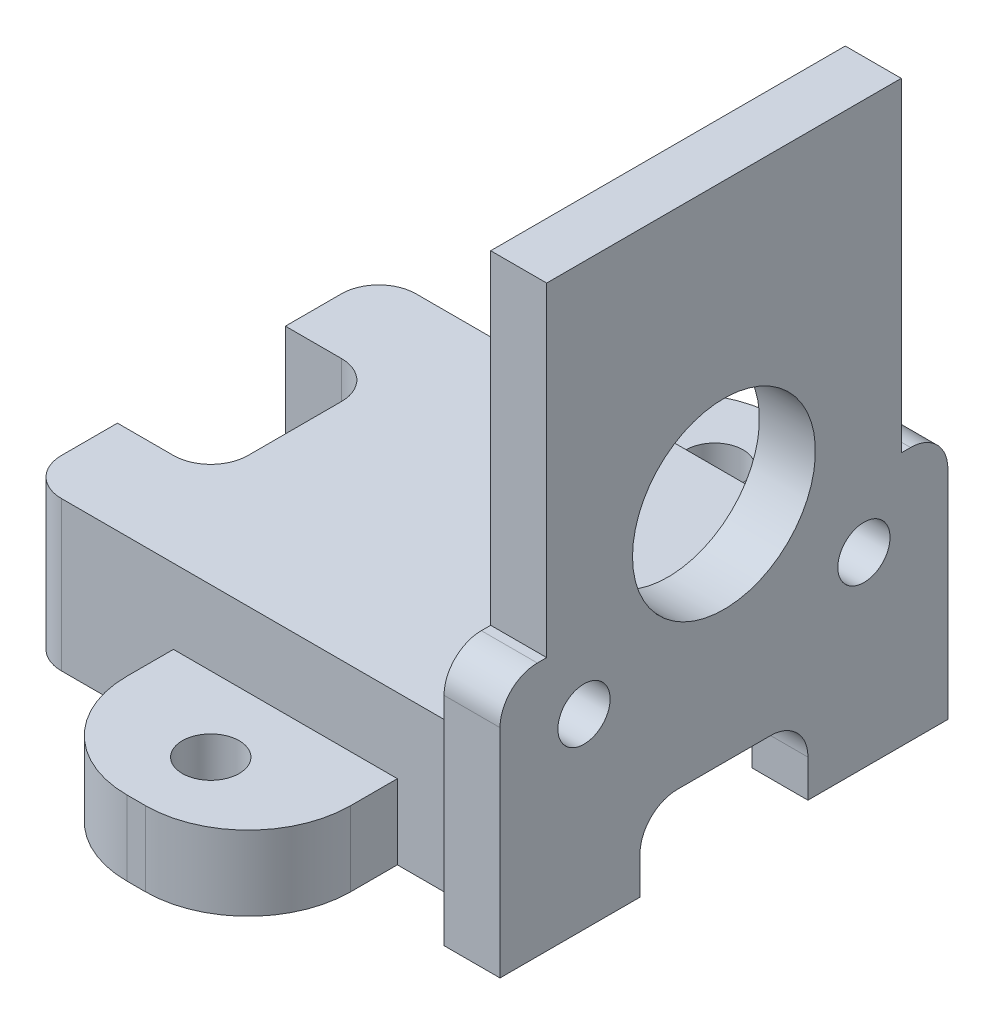
from build123d import *

# Parameters (mm, degrees)
SKETCH1_W           = 22
SKETCH1_H           = 13
BOSS_EXTRUDE1_DEPTH = 6
BOSS_EXTRUDE2_DEPTH = 2
BOSS_EXTRUDE3_DEPTH = 8
SKETCH4_R           = 1.525
SKETCH4_R_2         = 1.524
CUT_EXTRUDE1_DEPTH  = 36.566838488
SKETCH5_W           = 9
SKETCH5_H           = 4
CUT_EXTRUDE2_DEPTH  = 38.735924528
FILLET1_R           = 2
SKETCH6_W           = 12
SKETCH6_H           = 13.009000019
SKETCH6_W_2         = 15.838286437
CUT_EXTRUDE3_DEPTH  = 4
BOSS_EXTRUDE4_DEPTH = 23
CUT_EXTRUDE4_DEPTH  = 23
SKETCH9_R           = 4.9
CUT_EXTRUDE6_DEPTH  = 23
SKETCH10_R          = 1.4
CUT_EXTRUDE7_DEPTH  = 23
BOSS_EXTRUDE5_DEPTH = 3
FILLET2_R           = 2.5
FILLET3_R           = 2.5


with BuildPart() as part:
    # Sketch1 → Boss-Extrude1 (new body)
    with BuildSketch(Plane(origin=(0, 0, 0), x_dir=(1, 0, 0), z_dir=(0, 1, 0))):
        with BuildLine():
            Line((-1, -3), (23, -3))
            Line((23, -3), (25, -3))
            Line((25, -3), (25, -1))
            Line((25, -1), (25, 14))
            Line((25, 14), (25, 16))
            Line((25, 16), (23, 16))
            Line((23, 16), (-1, 16))
            ThreePointArc((-1, 16), (-2.414213562, 15.414213562), (-3, 14))
            Line((-3, 14), (-3, -1))
            ThreePointArc((-3, -1), (-2.414213562, -2.414213562), (-1, -3))
        make_face()
        with Locations((11, 6.5)):
            Rectangle(SKETCH1_W, SKETCH1_H, mode=Mode.SUBTRACT)
    extrude(amount=BOSS_EXTRUDE1_DEPTH)

    # Sketch2 → Boss-Extrude2 (add)
    with BuildSketch(Plane(origin=(0, 6, 0), x_dir=(1, 0, 0), z_dir=(0, 1, 0))):
        with BuildLine():
            Line((25, 14), (25, -1))
            Line((25, -1), (25, -3))
            Line((25, -3), (23, -3))
            Line((23, -3), (-1, -3))
            ThreePointArc((-1, -3), (-2.414213562, -2.414213562), (-3, -1))
            Line((-3, -1), (-3, 14))
            ThreePointArc((-3, 14), (-2.414213562, 15.414213562), (-1, 16))
            Line((-1, 16), (23, 16))
            Line((23, 16), (25, 16))
            Line((25, 16), (25, 14))
        make_face()
    extrude(amount=BOSS_EXTRUDE2_DEPTH)

    # Sketch3 → Boss-Extrude3 (add)
    with BuildSketch(Plane.XZ):
        with BuildLine():
            Line((5, 3), (17, 3))
            Line((17, 3), (17, 5.5))
            ThreePointArc((17, 5.5), (15.389087297, 9.389087297), (11.5, 11))
            Line((11.5, 11), (10.5, 11))
            ThreePointArc((10.5, 11), (6.610912703, 9.389087297), (5, 5.5))
            Line((5, 5.5), (5, 3))
        make_face()
        with BuildLine():
            Line((17, -16), (5, -16))
            Line((5, -16), (5, -18.5))
            ThreePointArc((5, -18.5), (6.610912703, -22.389087297), (10.5, -24))
            Line((10.5, -24), (11.5, -24))
            ThreePointArc((11.5, -24), (15.389087297, -22.389087297), (17, -18.5))
            Line((17, -18.5), (17, -16))
        make_face()
    extrude(amount=-BOSS_EXTRUDE3_DEPTH)

    # Sketch4 → Cut-Extrude1 (cut, through all)
    with BuildSketch(Plane(origin=(0, 0, 0), x_dir=(-1, 0, 0), z_dir=(0, -1, 0))):
        with Locations(Location((-11, 20, 0), (0, 0, 90))):
            Circle(SKETCH4_R)
        with Locations(Location((-11, -7, 0), (0, 0, 90))):
            Circle(SKETCH4_R_2)
    extrude(amount=-CUT_EXTRUDE1_DEPTH, mode=Mode.SUBTRACT)

    # Sketch5 → Cut-Extrude2 (cut, through all)
    with BuildSketch(Plane(origin=(25, 0, 0), x_dir=(0, 0, -1), z_dir=(1, 0, 0))):
        with Locations((6.5, 2)):
            Rectangle(SKETCH5_W, SKETCH5_H)
    extrude(amount=-CUT_EXTRUDE2_DEPTH, mode=Mode.SUBTRACT)

    # Fillet1
    fillet1_edges = [part.edges().sort_by_distance(p)[0] for p in [
        (-1.5, 4, -11),
        (-1.5, 4, -2),
        (23.5, 4, -11),
        (23.5, 4, -2),
    ]]
    fillet(fillet1_edges, radius=FILLET1_R)

    # Sketch6 → Cut-Extrude3 (cut)
    with BuildSketch(Plane(origin=(0, 8, 0), x_dir=(1, 0, 0), z_dir=(0, 1, 0))):
        with Locations((11, 22.504500009)):
            Rectangle(SKETCH6_W, SKETCH6_H)
        with Locations((11.149066226, -9.50450001)):
            Rectangle(SKETCH6_W_2, SKETCH6_H)
    extrude(amount=-CUT_EXTRUDE3_DEPTH, mode=Mode.SUBTRACT)

    # Sketch7 → Boss-Extrude4 (add)
    with BuildSketch(Plane(origin=(0, 8, 0), x_dir=(1, 0, 0), z_dir=(0, 1, 0))):
        Polygon((23, 16), (22, 16), (22, -3), (23, -3), (25, -3), (25, -1), (25, 14), (25, 16), align=None)
    extrude(amount=BOSS_EXTRUDE4_DEPTH)

    # Sketch8 → Cut-Extrude4 (cut)
    with BuildSketch(Plane(origin=(0, 8, 0), x_dir=(1, 0, 0), z_dir=(0, 1, 0))):
        with BuildLine():
            Line((-3, 2), (0, 2))
            ThreePointArc((0, 2), (1.414213562, 2.585786438), (2, 4))
            Line((2, 4), (2, 9))
            ThreePointArc((2, 9), (1.414213562, 10.414213562), (0, 11))
            Line((0, 11), (-3, 11))
            Line((-3, 11), (-3, 2))
        make_face()
    extrude(amount=-CUT_EXTRUDE4_DEPTH, mode=Mode.SUBTRACT)

    # Sketch9 → Cut-Extrude6 (cut)
    with BuildSketch(Plane.ZY.offset(-22)):
        with Locations((-6.5, 16)):
            Circle(SKETCH9_R)
    extrude(amount=-CUT_EXTRUDE6_DEPTH, mode=Mode.SUBTRACT)

    # Sketch10 → Cut-Extrude7 (cut)
    with BuildSketch(Plane.ZY.offset(-22)):
        with Locations((-14, 10)):
            Circle(SKETCH10_R)
        with Locations((1, 10)):
            Circle(SKETCH10_R)
    extrude(amount=-CUT_EXTRUDE7_DEPTH, mode=Mode.SUBTRACT)

    # Sketch11 → Boss-Extrude5 (add)
    with BuildSketch(Plane(origin=(25, 0, 0), x_dir=(0, 0, -1), z_dir=(1, 0, 0))):
        with BuildLine():
            Line((-3, 0), (-5.5, 0))
            Line((-5.5, 0), (-5.5, 11.617902622))
            ThreePointArc((-5.5, 11.617902622), (-4.914213562, 13.032116185), (-3.5, 13.617902622))
            Line((-3.5, 13.617902622), (-3, 13.617902622))
            Line((-3, 13.617902622), (-3, 0))
        make_face()
        with BuildLine():
            Line((16, 0), (18.5, 0))
            Line((18.5, 0), (18.5, 11.617902622))
            ThreePointArc((18.5, 11.617902622), (17.914213562, 13.032116185), (16.5, 13.617902622))
            Line((16.5, 13.617902622), (16, 13.617902622))
            Line((16, 13.617902622), (16, 0))
        make_face()
    extrude(amount=-BOSS_EXTRUDE5_DEPTH)

    # Fillet2
    fillet2_edges = [part.edges().sort_by_distance(p)[0] for p in [
        (22, 4, 3),
    ]]
    fillet(fillet2_edges, radius=FILLET2_R - 0.0001)  # a hair under: the kernel refuses the full size

    # Fillet3
    fillet3_edges = [part.edges().sort_by_distance(p)[0] for p in [
        (22, 4, -16),
    ]]
    fillet(fillet3_edges, radius=FILLET3_R - 0.0001)  # a hair under: the kernel refuses the full size


solid = part.part
